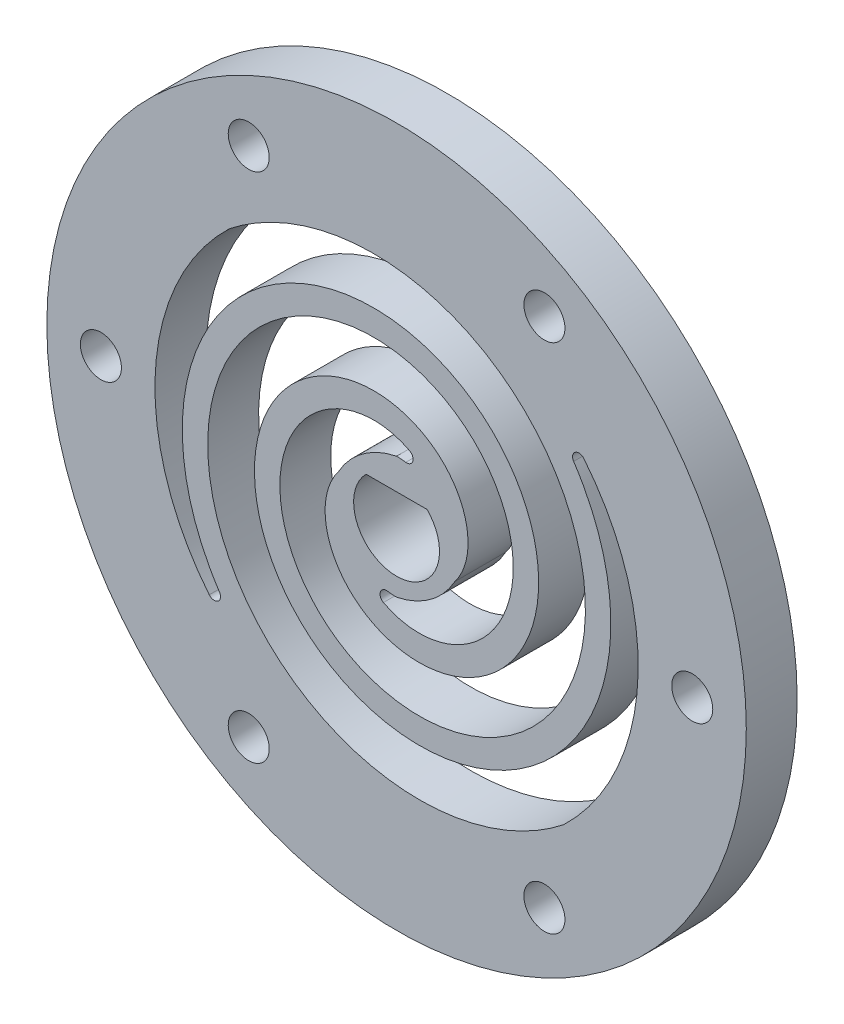
from build123d import *

# Parameters (mm, degrees)
SKETCH1_R               = 27.5
SKETCH1_R_2             = 19
BOSS_EXTRUDE1_DEPTH     = 4
SKETCH1_R_3             = 4.8
BOSS_EXTRUDE1_2_DEPTH   = 4
EXTRUDE_THIN1_DEPTH     = 4
CIRPATTERN1_COUNT       = 2
SKETCH9_R               = 4.086461839
BOSS_EXTRUDE3_DEPTH     = 2.5
CUT_EXTRUDE2_REACH      = 41.096
SKETCH4_R               = 1.6125
CIRPATTERN2_COUNT       = 6
CUT_EXTRUDE3_DEPTH      = 40.096035756
CUT_EXTRUDE3_DEPTH_BACK = 40.096035756
CUT_EXTRUDE4_REACH      = 41.096
FILLET3_R               = 0.5


# Read off the part's stored shape, not the designer's step: Extrude-Thin1
with BuildPart() as part:
    # Sketch1 → Boss-Extrude1 (new body)
    with BuildSketch(Plane.XY):
        Circle(SKETCH1_R)
        Circle(SKETCH1_R_2, mode=Mode.SUBTRACT)
    extrude(amount=BOSS_EXTRUDE1_DEPTH)



with BuildPart() as body_2:
    # Sketch1 → Boss-Extrude1 2 (new body)
    with BuildSketch(Plane.XY):
        Circle(SKETCH1_R_3)
    extrude(amount=BOSS_EXTRUDE1_2_DEPTH)


with BuildPart() as part_1:
    add(part.part)

    add(body_2.part)  # Extrude-Thin1 merges body 2
    # Extrude-Thin1 outline → Extrude-Thin1 (add)
    with BuildSketch(Plane.XY):
        with BuildLine():
            ThreePointArc((-3.108383055, -3.657588657), (-4.614683908, -1.320868061), (-4.572901435, 1.458962803))
            add(Edge.make_bspline(
                [(-4.572901435, 1.458962803), (-4.855470926, 1.094863493), (-5.092389525, 0.677260697), (-5.475025276, -0.322478427), (-5.596543423, -0.914014078), (-5.635067196, -2.158120342), (-5.551671719, -2.804167906), (-5.160084594, -4.085630128), (-4.853530663, -4.715025251), (-4.0200099, -5.885814032), (-3.496370389, -6.422208421), (-2.259130972, -7.33226996), (-1.550106751, -7.702340429), (0.002791035, -8.21629049), (0.841341497, -8.358214348), (2.577752087, -8.371615404), (3.470066966, -8.242866989), (5.224780858, -7.696235602), (6.081924908, -7.279799209), (7.672048277, -6.168668168), (8.400525963, -5.47689817), (9.643801179, -3.856614785), (10.155230949, -2.932193746), (10.889500583, -0.916641551), (11.110377635, 0.16962812), (11.212190246, 2.415588976), (11.092711016, 3.570101931), (10.493064254, 5.844028949), (10.014036565, 6.95841616), (8.70945828, 9.038437186), (7.886474683, 9.999640467), (5.94404138, 11.665745573), (4.828337395, 12.367198334), (2.383787445, 13.423653378), (1.059519353, 13.776482072), (-1.69171552, 14.073137993), (-3.113686308, 14.016246414), (-5.931997037, 13.466527309), (-7.323368358, 12.974486564), (-9.945812484, 11.568072605), (-11.172382669, 10.65591111), (-13.33704626, 8.464573846), (-14.271497339, 7.18883076), (-15.743131537, 4.364491624), (-16.277849107, 2.820240417), (-16.8723103, -0.414946557), (-16.930977159, -2.101011665), (-16.536007552, -5.47197287), (-16.082772996, -7.151902636), (-14.67290914, -10.354020842), (-13.718121061, -11.871583896), (-11.361995693, -14.598152532), (-9.96377427, -15.80327902), (-7.720924179, -17.210874909), (-7.017768014, -17.592090842), (-6.28895119, -17.929001448)],
                knots=[0.004430584, 0.004430584, 0.004430584, 0.004430584, 0.03125, 0.03125, 0.0625, 0.0625, 0.09375, 0.09375, 0.125, 0.125, 0.15625, 0.15625, 0.1875, 0.1875, 0.21875, 0.21875, 0.25, 0.25, 0.28125, 0.28125, 0.3125, 0.3125, 0.34375, 0.34375, 0.375, 0.375, 0.40625, 0.40625, 0.4375, 0.4375, 0.46875, 0.46875, 0.5, 0.5, 0.53125, 0.53125, 0.5625, 0.5625, 0.59375, 0.59375, 0.625, 0.625, 0.65625, 0.65625, 0.6875, 0.6875, 0.71875, 0.71875, 0.75, 0.75, 0.78125, 0.78125, 0.8125, 0.8125, 0.825878057, 0.825878057, 0.825878057, 0.825878057], degree=3))
            ThreePointArc((-6.28895119, -17.929001448), (4.017728037, -18.570348985), (13.137575262, -13.726037893))
            add(Edge.make_bspline(
                [(-3.108383055, -3.657588657), (-3.019895488, -3.821392552), (-2.919604892, -3.983006114), (-2.515531961, -4.550579325), (-2.140024533, -4.937102361), (-1.245362848, -5.595178057), (-0.721773312, -5.86979716), (0.431261097, -6.251407663), (1.065714485, -6.359886424), (2.384248888, -6.370062447), (3.073412475, -6.271634423), (4.431739701, -5.848486069), (5.10559086, -5.522130857), (6.357239667, -4.6475158), (6.938923257, -4.09633507), (7.931979216, -2.802146905), (8.346119598, -2.055253096), (8.940242321, -0.424400748), (9.121669049, 0.464022066), (9.205002385, 2.302334719), (9.106946428, 3.256846055), (8.611052348, 5.137331401), (8.211885769, 6.067665952), (7.122962665, 7.803846126), (6.430669449, 8.61341009), (4.795634002, 10.015847384), (3.849404179, 10.611483129), (1.775895618, 11.507586143), (0.644510808, 11.809638028), (-1.705527177, 12.063034309), (-2.928527542, 12.014671718), (-5.351376294, 11.542088538), (-6.55542387, 11.116870522), (-8.823270198, 9.90062698), (-9.890752693, 9.10742687), (-11.772982783, 7.202003342), (-12.590583821, 6.086641398), (-13.876709983, 3.61832661), (-14.347021843, 2.261564084), (-14.869001453, -0.579162367), (-14.921250008, -2.067261482), (-14.572911991, -5.040234389), (-14.171668387, -6.529201067), (-12.92314645, -9.364875454), (-12.07404949, -10.715275825), (-9.97952298, -13.13911556), (-8.731289181, -14.215529996), (-5.928919608, -15.974276114), (-4.371252873, -16.658615159), (-1.074925401, -17.545944226), (0.667674798, -17.749811563), (4.184406682, -17.628841906), (5.962537172, -17.303690302), (9.389124069, -16.123988963), (11.041289119, -15.267975167), (12.747985339, -14.027225348), (12.944084962, -13.878678599), (13.137575262, -13.726037893)],
                knots=[0.112999786, 0.112999786, 0.112999786, 0.112999786, 0.125, 0.125, 0.15625, 0.15625, 0.1875, 0.1875, 0.21875, 0.21875, 0.25, 0.25, 0.28125, 0.28125, 0.3125, 0.3125, 0.34375, 0.34375, 0.375, 0.375, 0.40625, 0.40625, 0.4375, 0.4375, 0.46875, 0.46875, 0.5, 0.5, 0.53125, 0.53125, 0.5625, 0.5625, 0.59375, 0.59375, 0.625, 0.625, 0.65625, 0.65625, 0.6875, 0.6875, 0.71875, 0.71875, 0.75, 0.75, 0.78125, 0.78125, 0.8125, 0.8125, 0.84375, 0.84375, 0.875, 0.875, 0.90625, 0.90625, 0.9375, 0.9375, 0.941613921, 0.941613921, 0.941613921, 0.941613921], degree=3))
        make_face()
    extrude_thin1 = extrude(amount=EXTRUDE_THIN1_DEPTH)

    # CirPattern1: Extrude-Thin1 ×2 about axis
    cirpattern1_axis = Axis((0, 0, 4), (0, 0, -1))
    for i in range(1, CIRPATTERN1_COUNT):
        add(extrude_thin1.rotate(cirpattern1_axis, i * 360 / CIRPATTERN1_COUNT))

    # Sketch9 → Boss-Extrude3 (add)
    with BuildSketch(Plane(origin=(0, 0, 0), x_dir=(-1, 0, 0), z_dir=(0, 0, -1))):
        with Locations(Location((0, 0, 0), (0, 0, 180))):
            Circle(SKETCH9_R)
    extrude(amount=BOSS_EXTRUDE3_DEPTH)

    # Sketch4 → Cut-Extrude2 (cut, up to next)
    with BuildSketch(Plane.XY, mode=Mode.PRIVATE) as cut_extrude2_sk1:
        with Locations((-23.25, 0)):
            Circle(SKETCH4_R)
    cut_extrude2_tool1 = extrude(cut_extrude2_sk1.sketch, amount=CUT_EXTRUDE2_REACH, mode=Mode.PRIVATE) & part_1.part
    cut_extrude2 = cut_extrude2_tool1.solids().sort_by_distance((-23.25, 0, 0))[0]
    add(cut_extrude2, mode=Mode.SUBTRACT)

    # CirPattern2: Cut-Extrude2 ×6 about axis
    cirpattern2_axis = Axis((0, 0, 0), (0, 0, 1))
    for i in range(1, CIRPATTERN2_COUNT):
        add(cut_extrude2.rotate(cirpattern2_axis, i * 360 / CIRPATTERN2_COUNT), mode=Mode.SUBTRACT)

    # Sketch6 → Cut-Extrude3 (cut, two sides: drawn at the far end of the back side and taken through both)
    with BuildSketch(Plane.XY.offset(-CUT_EXTRUDE3_DEPTH_BACK)):
        with BuildLine():
            Line((-2.397915762, 2.375), (2.397915762, 2.375))
            ThreePointArc((2.397915762, 2.375), (0, -3.375), (-2.397915762, 2.375))
        make_face()
    extrude(amount=CUT_EXTRUDE3_DEPTH + CUT_EXTRUDE3_DEPTH_BACK, mode=Mode.SUBTRACT)

    # Sketch7 → Cut-Extrude4 (cut, up to next)
    with BuildSketch(Plane.XY, mode=Mode.PRIVATE) as cut_extrude4_sk1:
        with BuildLine():
            ThreePointArc((-4.572901435, 1.458962803), (-2.831693711, 3.875759374), (0, 4.8))
            ThreePointArc((0, 4.8), (-2.654094139, 3.632677573), (-4.572901435, 1.458962803))
        make_face()
    cut_extrude4_tool1 = extrude(cut_extrude4_sk1.sketch, amount=CUT_EXTRUDE4_REACH, mode=Mode.PRIVATE) & part_1.part
    # Sketch7 → Cut-Extrude4 (cut, up to next)
    with BuildSketch(Plane.XY, mode=Mode.PRIVATE) as cut_extrude4_sk2:
        with BuildLine():
            ThreePointArc((4.572901435, -1.458962803), (2.831693711, -3.875759374), (0, -4.8))
            ThreePointArc((0, -4.8), (2.654094139, -3.632677573), (4.572901435, -1.458962803))
        make_face()
    cut_extrude4_tool2 = extrude(cut_extrude4_sk2.sketch, amount=CUT_EXTRUDE4_REACH, mode=Mode.PRIVATE) & part_1.part
    add(cut_extrude4_tool1.solids().sort_by_distance((-2.798283, 3.83003, 0))[0], mode=Mode.SUBTRACT)
    add(cut_extrude4_tool2.solids().sort_by_distance((2.798283, -3.83003, 0))[0], mode=Mode.SUBTRACT)

    # Fillet3
    fillet3_edges = [part_1.edges().sort_by_distance(p)[0] for p in [
        (-6.28895119, -17.929001448, 2),
        (-3.108383055, -3.657588657, 2),
        (3.108383055, 3.657588657, 2),
        (6.28895119, 17.929001448, 2),
    ]]
    fillet(fillet3_edges, radius=FILLET3_R)


solid = part_1.part
